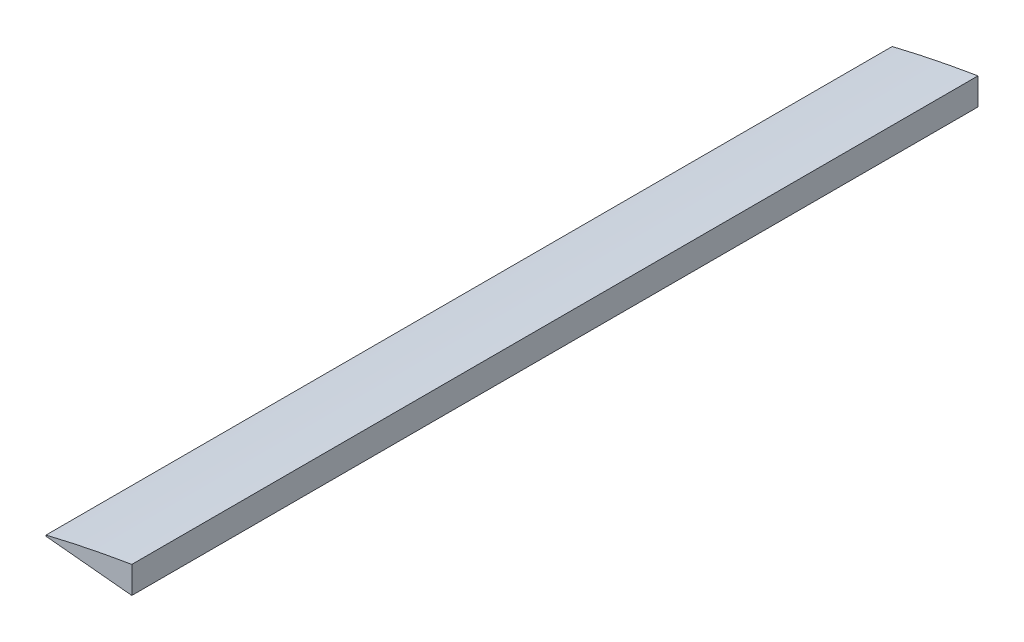
from build123d import *

# Parameters (mm, degrees)
BOSS_EXTRUDE1_DEPTH = 612


with BuildPart() as part:
    # Sketch1 → Boss-Extrude1 (new body)
    with BuildSketch(Plane.XY):
        with BuildLine():
            Line((-176.6195, 13.023106532), (-176.6195, -6.454370506))
            add(Edge.make_bspline(
                [(-176.6195, -6.454370506), (-178.188753482, -6.312108504), (-182.359886546, -5.933970906), (-188.990421054, -5.317886092), (-196.354680808, -4.624175058), (-203.248712282, -3.963626977), (-209.62869232, -3.342836229), (-215.453758548, -2.767226084), (-220.686424709, -2.242558309), (-225.292785947, -1.773651832), (-229.242958683, -1.367494124), (-232.510834876, -1.023880308), (-235.075678546, -0.760955177), (-236.918777596, -0.548714441), (-238.031628616, -0.459131063), (-238.533564191, -0.37457711), (-238.666663293, -0.375050863), (-238.675, -0.375080537)],
                knots=[0, 0, 0, 0, 0.075810952, 0.201508279, 0.320388141, 0.43169539, 0.534719075, 0.628797147, 0.713321079, 0.787740393, 0.851567051, 0.904379655, 0.945827345, 0.975633259, 0.993597432, 0.999598973, 1, 1, 1, 1], degree=3))
            Line((-238.675, -0.375080537), (-238.675, 0.381187438))
            add(Edge.make_bspline(
                [(-176.6195, 13.023106532), (-178.431906242, 12.722514089), (-182.841851447, 11.991112834), (-189.692146989, 10.770798), (-197.014934224, 9.410710515), (-203.85370055, 8.079649627), (-210.168190111, 6.800350463), (-215.920851847, 5.591313194), (-221.077844998, 4.471477539), (-225.608999593, 3.458735797), (-229.487989995, 2.569844864), (-232.692417393, 1.819938109), (-235.203893789, 1.222163619), (-237.008061317, 0.787162185), (-238.08635023, 0.525005253), (-238.562115977, 0.408767052), (-238.675, 0.381187438)],
                knots=[0, 0, 0, 0, 0.087007005, 0.211705365, 0.329527113, 0.439740645, 0.541660709, 0.634652346, 0.718134669, 0.791584505, 0.854539888, 0.906603358, 0.947445002, 0.976805146, 0.994496602, 1, 1, 1, 1], degree=3))
        make_face()
    extrude(amount=BOSS_EXTRUDE1_DEPTH)


solid = part.part
